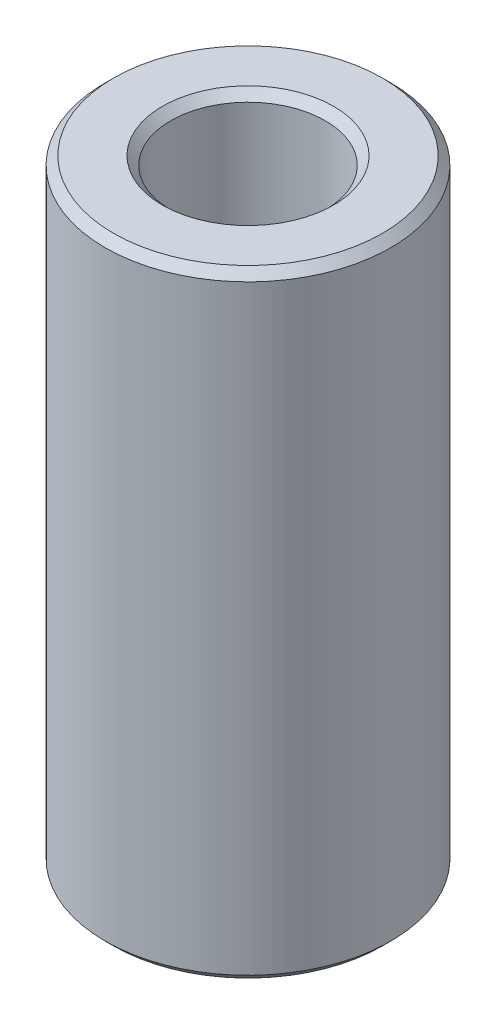
from build123d import *

# Parameters (mm, degrees)
SKETCH1_R           = 25
BOSS_EXTRUDE1_DEPTH = 108.041205704
SKETCH2_R           = 13.531902712
CUT_EXTRUDE1_DEPTH  = 114.678943213
CHAMFER1_SIZE       = 1.456512611


with BuildPart() as part:
    # Sketch1 → Boss-Extrude1 (new body)
    with BuildSketch(Plane(origin=(0, 0, 0), x_dir=(1, 0, 0), z_dir=(0, 1, 0))):
        Circle(SKETCH1_R)
    extrude(amount=BOSS_EXTRUDE1_DEPTH)

    # Sketch2 → Cut-Extrude1 (cut, through all)
    with BuildSketch(Plane(origin=(0, 0, 0), x_dir=(1, 0, 0), z_dir=(0, 1, 0))):
        Circle(SKETCH2_R)
    extrude(amount=CUT_EXTRUDE1_DEPTH, mode=Mode.SUBTRACT)

    # Chamfer1
    chamfer1_edges = [part.edges().sort_by_distance(p)[0] for p in [
        (-13.531902712, 108.041205704, 0),
        (-13.531902712, 0, 0),
        (-25, 0, 0),
        (-25, 108.041205704, 0),
    ]]
    chamfer(chamfer1_edges, length=CHAMFER1_SIZE)


solid = part.part
